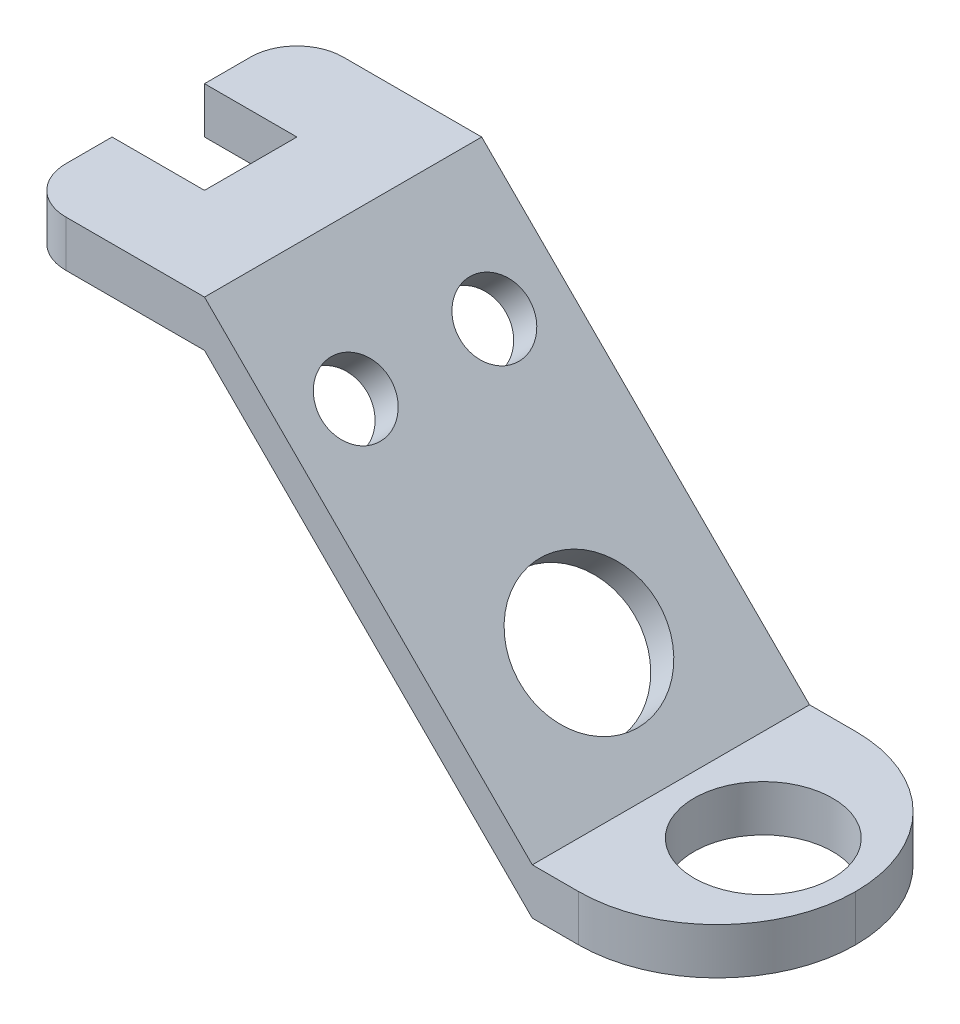
from build123d import *

# Parameters (mm, degrees)
SALIENTE_EXTRUIR1_DEPTH    = 60
CROQUIS3_W                 = 40
CROQUIS3_H                 = 20
CORTAR_EXTRUIR1_DEPTH      = 46
CROQUIS4_R                 = 15
CORTAR_EXTRUIR5_DEPTH      = 57
CORTAR_EXTRUIR6_DEPTH      = 16
CORTAR_EXTRUIR6_DEPTH_BACK = 19
CROQUIS12_R                = 7.5
CROQUIS12_R_2              = 15
REDONDEO2_R                = 10
REDONDEO3_R                = 30


with BuildPart() as part:
    # Croquis2 → Saliente-Extruir1 (new body)
    with BuildSketch(Plane.XY):
        Polygon((-36.180131723, 22.907142857), (3.819868277, 22.907142857), (74.767829948, -48.040818814), (114.767829948, -48.040818814), (114.767829948, -38.040818814), (74.767829948, -38.040818814), (3.819868277, 32.907142857), (-36.180131723, 32.907142857), align=None)
    extrude(amount=SALIENTE_EXTRUIR1_DEPTH)

    # Croquis3 → Cortar-Extruir1 (cut)
    with BuildSketch(Plane(origin=(0, 0, 0), x_dir=(1, 0, 0), z_dir=(0, 1, 0))):
        with Locations((-36.180131723, -30)):
            Rectangle(CROQUIS3_W, CROQUIS3_H)
    extrude(amount=CORTAR_EXTRUIR1_DEPTH, mode=Mode.SUBTRACT)

    # Croquis4 → Cortar-Extruir5 (cut)
    with BuildSketch(Plane(origin=(0, 0, 0), x_dir=(1, 0, 0), z_dir=(0, 1, 0))):
        with Locations(Location((94.767829948, -30, 0), (0, 0, 270))):
            Circle(CROQUIS4_R)
    extrude(amount=-CORTAR_EXTRUIR5_DEPTH, mode=Mode.SUBTRACT)

    # Croquis12 → Cortar-Extruir6 (cut, two sides: drawn at the far end of the back side and taken through both)
    with BuildSketch(Plane(origin=(18.363505567, 18.363505567, 0), x_dir=(0, 0, -1), z_dir=(0.7071067811865486, 0.7071067811865465, 0)).offset(-CORTAR_EXTRUIR6_DEPTH_BACK)):
        with Locations(Location((-15, -4.516083302, 0), (0, 0, 270))):
            Circle(CROQUIS12_R)
        with Locations(Location((-45, -4.516083302, 0), (0, 0, 270))):
            Circle(CROQUIS12_R)
        with Locations(Location((-30, -54.683868112, 0), (0, 0, 270))):
            Circle(CROQUIS12_R_2)
    extrude(amount=CORTAR_EXTRUIR6_DEPTH + CORTAR_EXTRUIR6_DEPTH_BACK, mode=Mode.SUBTRACT)

    # Redondeo2
    redondeo2_edges = [part.edges().sort_by_distance(p)[0] for p in [
        (-36.180131723, 27.907142857, 0),
        (-36.180131723, 27.907142857, 60),
    ]]
    fillet(redondeo2_edges, radius=REDONDEO2_R)

    # Redondeo3
    redondeo3_edges = [part.edges().sort_by_distance(p)[0] for p in [
        (114.767829948, -43.040818814, 60),
        (114.767829948, -43.040818814, 0),
    ]]
    fillet(redondeo3_edges, radius=REDONDEO3_R - 0.0001)  # a hair under: the kernel refuses the full size


solid = part.part
